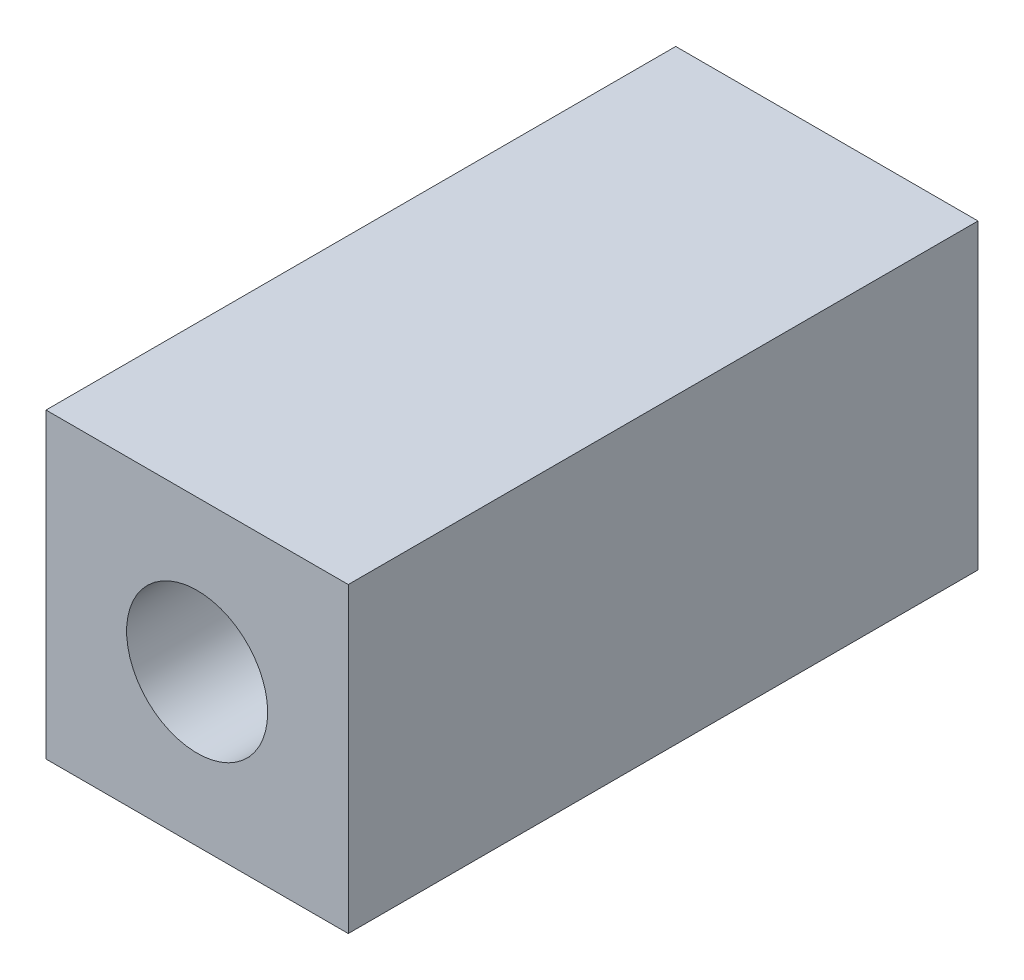
from build123d import *

# Parameters (mm, degrees)
SKETCH1_W           = 6
SKETCH1_H           = 6
SKETCH1_R           = 1.4
BOSS_EXTRUDE1_DEPTH = 12.5


with BuildPart() as part:
    # Sketch1 → Boss-Extrude1 (new body)
    with BuildSketch(Plane.XY):
        Rectangle(SKETCH1_W, SKETCH1_H)
        Circle(SKETCH1_R, mode=Mode.SUBTRACT)
    extrude(amount=BOSS_EXTRUDE1_DEPTH)


solid = part.part
